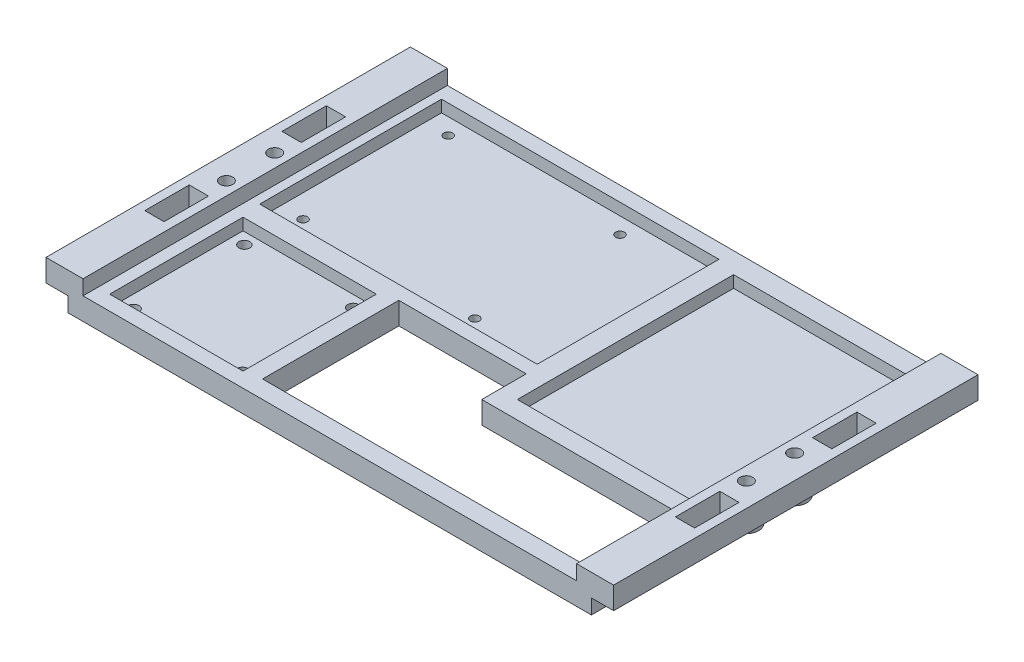
from build123d import *

# Parameters (mm, degrees)
PLATEFRAME_DEPTH          = 150
SKETCH3_R                 = 2.5
HOLESUPPORT_DEPTH         = 244.653052515
SKETCH4_R                 = 4.15
SKETCH4_R_2               = 2.15
CYLINDRICALSUPPORTS_DEPTH = 12.5
SKETCH5_W                 = 43
SKETCH5_H                 = 43
SKETCH5_W_2               = 89.65
SKETCH5_H_2               = 57.35
SKETCH5_W_3               = 58
SKETCH5_H_3               = 73
ITEMLAYOUT_DEPTH          = 4
HOLECUTOUT_DEPTH          = 7.5
SKETCH7_R                 = 1.5
HOLERASPBERRYPI_DEPTH     = 3.5
SKETCH8_R                 = 1.85
HOLEMOTORDRIVER_DEPTH     = 3.5
SKETCH10_W                = 45
SKETCH10_H                = 45
SKETCH10_W_2              = 43
SKETCH10_H_2              = 43
CUTMOTORDRIVER_DEPTH      = 4
SKETCH11_W                = 93.65
SKETCH11_H                = 61.35
SKETCH11_W_2              = 89.65
SKETCH11_H_2              = 57.35
CUTPASPBERRYPI_DEPTH      = 4
SKETCH12_W                = 191.6
SKETCH12_H                = 13
SKETCH12_H_2              = 14
CUTPLATEEDGES_DEPTH       = 12.5
SKETCH13_W                = 6.5
SKETCH13_H                = 15
CUTSHELLHOLES_DEPTH       = 12.5


with BuildPart() as part:
    # Sketch2 → PlateFrame (new body)
    with BuildSketch(Plane.XY):
        Polygon((179.1, 12.5), (191.6, 12.5), (191.6, 5), (184.1, 5), (184.1, 0), (7.5, 0), (7.5, 5), (0, 5), (0, 12.5), (12.5, 12.5), (12.5, 7.5), (179.1, 7.5), align=None)
    extrude(amount=PLATEFRAME_DEPTH)

    # Sketch3 → HoleSupport (cut, through all)
    with BuildSketch(Plane(origin=(0, 12.5, 0), x_dir=(1, 0, 0), z_dir=(0, 1, 0))):
        with Locations((8.05, -66.85)):
            Circle(SKETCH3_R)
        with Locations((8.05, -83.15)):
            Circle(SKETCH3_R)
        with Locations((183.55, -66.85)):
            Circle(SKETCH3_R)
        with Locations((183.55, -83.15)):
            Circle(SKETCH3_R)
    extrude(amount=-HOLESUPPORT_DEPTH, mode=Mode.SUBTRACT)

    # Sketch4 → CylindricalSupports (add)
    # profile 1 of 4: a face of its own
    with BuildSketch(Plane(origin=(0, 12.5, 0), x_dir=(1, 0, 0), z_dir=(0, 1, 0))):
        with Locations((183.55, -66.85)):
            Circle(SKETCH4_R)
        with Locations((183.55, -66.85)):
            Circle(SKETCH4_R_2, mode=Mode.SUBTRACT)
    # profile 2 of 4: a face of its own
    with BuildSketch(Plane(origin=(0, 12.5, 0), x_dir=(1, 0, 0), z_dir=(0, 1, 0))):
        with Locations((183.55, -83.15)):
            Circle(SKETCH4_R)
        with Locations((183.55, -83.15)):
            Circle(SKETCH4_R_2, mode=Mode.SUBTRACT)
    # profile 3 of 4: a face of its own
    with BuildSketch(Plane(origin=(0, 12.5, 0), x_dir=(1, 0, 0), z_dir=(0, 1, 0))):
        with Locations((8.05, -66.85)):
            Circle(SKETCH4_R)
        with Locations((8.05, -66.85)):
            Circle(SKETCH4_R_2, mode=Mode.SUBTRACT)
    # profile 4 of 4: a face of its own
    with BuildSketch(Plane(origin=(0, 12.5, 0), x_dir=(1, 0, 0), z_dir=(0, 1, 0))):
        with Locations((8.05, -83.15)):
            Circle(SKETCH4_R)
        with Locations((8.05, -83.15)):
            Circle(SKETCH4_R_2, mode=Mode.SUBTRACT)
    extrude(amount=-CYLINDRICALSUPPORTS_DEPTH)

    # Sketch5 → ItemLayout (cut)
    with BuildSketch(Plane(origin=(0, 7.5, 0), x_dir=(1, 0, 0), z_dir=(0, 1, 0))):
        with Locations((39, -108.5)):
            Rectangle(SKETCH5_W, SKETCH5_H)
        with Locations((62.325, -48.675)):
            Rectangle(SKETCH5_W_2, SKETCH5_H_2)
        with Locations((145.1, -56.5)):
            Rectangle(SKETCH5_W_3, SKETCH5_H_3)
    extrude(amount=-ITEMLAYOUT_DEPTH, mode=Mode.SUBTRACT)

    # Sketch6 → HoleCutout (cut)
    with BuildSketch(Plane(origin=(0, 7.5, 0), x_dir=(1, 0, 0), z_dir=(0, 1, 0))):
        Polygon((67.1, -84), (110.1, -84), (110.1, -99), (174.1, -99), (174.1, -130), (110.1, -130), (67.1, -130), align=None)
    extrude(amount=-HOLECUTOUT_DEPTH, mode=Mode.SUBTRACT)

    # Sketch7 → HoleRaspberryPi (cut)
    with BuildSketch(Plane(origin=(0, 3.5, 0), x_dir=(1, 0, 0), z_dir=(0, 1, 0))):
        with Locations((23.26, -23.5)):
            Circle(SKETCH7_R)
        with Locations((23.26, -72.5)):
            Circle(SKETCH7_R)
        with Locations((81.26, -72.5)):
            Circle(SKETCH7_R)
        with Locations((81.26, -23.5)):
            Circle(SKETCH7_R)
    extrude(amount=-HOLERASPBERRYPI_DEPTH, mode=Mode.SUBTRACT)

    # Sketch8 → HoleMotorDriver (cut)
    with BuildSketch(Plane(origin=(0, 3.5, 0), x_dir=(1, 0, 0), z_dir=(0, 1, 0))):
        with Locations((57.56, -127.24)):
            Circle(SKETCH8_R)
        with Locations((57.56, -89.86)):
            Circle(SKETCH8_R)
        with Locations((20.81, -89.86)):
            Circle(SKETCH8_R)
        with Locations((20.81, -127.24)):
            Circle(SKETCH8_R)
    extrude(amount=-HOLEMOTORDRIVER_DEPTH, mode=Mode.SUBTRACT)

    # Sketch10 → CutMotorDriver (cut)
    with BuildSketch(Plane(origin=(0, 7.5, 0), x_dir=(1, 0, 0), z_dir=(0, 1, 0))):
        with Locations((39, -108.5)):
            Rectangle(SKETCH10_W, SKETCH10_H)
        with Locations((39, -108.5)):
            Rectangle(SKETCH10_W_2, SKETCH10_H_2, mode=Mode.SUBTRACT)
    extrude(amount=-CUTMOTORDRIVER_DEPTH, mode=Mode.SUBTRACT)

    # Sketch11 → CutPaspberryPi (cut)
    with BuildSketch(Plane(origin=(0, 7.5, 0), x_dir=(1, 0, 0), z_dir=(0, 1, 0))):
        with Locations((62.325, -48.675)):
            Rectangle(SKETCH11_W, SKETCH11_H)
        with Locations((62.325, -48.675)):
            Rectangle(SKETCH11_W_2, SKETCH11_H_2, mode=Mode.SUBTRACT)
    extrude(amount=-CUTPASPBERRYPI_DEPTH, mode=Mode.SUBTRACT)

    # Sketch12 → CutPlateEdges (cut)
    with BuildSketch(Plane(origin=(0, 12.5, 0), x_dir=(1, 0, 0), z_dir=(0, 1, 0))):
        with Locations((95.8, -6.5)):
            Rectangle(SKETCH12_W, SKETCH12_H)
        with Locations((95.8, -143)):
            Rectangle(SKETCH12_W, SKETCH12_H_2)
    extrude(amount=-CUTPLATEEDGES_DEPTH, mode=Mode.SUBTRACT)

    # Sketch13 → CutShellHoles (cut)
    with BuildSketch(Plane(origin=(0, 12.5, 0), x_dir=(1, 0, 0), z_dir=(0, 1, 0))):
        with Locations((6.25, -51.85)):
            Rectangle(SKETCH13_W, SKETCH13_H)
        with Locations((6.25, -98.15)):
            Rectangle(SKETCH13_W, SKETCH13_H)
        with Locations((185.35, -51.85)):
            Rectangle(SKETCH13_W, SKETCH13_H)
        with Locations((185.35, -98.15)):
            Rectangle(SKETCH13_W, SKETCH13_H)
    extrude(amount=-CUTSHELLHOLES_DEPTH, mode=Mode.SUBTRACT)


solid = part.part
